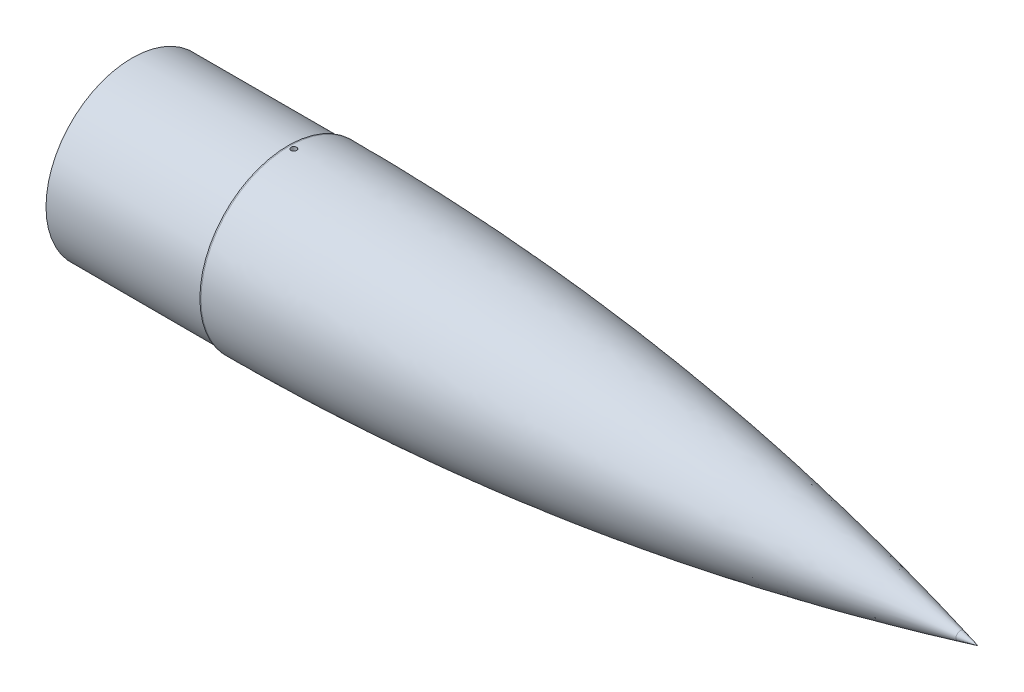
from build123d import *
from build123d.topology import SkipClean

# Parameters (mm, degrees)
ESQUISSE2_R                  = 76
ESQUISSE2_R_2                = 74
BOSS_EXTRU_1_DEPTH           = 138
ENL_V_MAT_EXTRU_1_DEPTH      = 649.747842898
ENL_V_MAT_EXTRU_1_DEPTH_BACK = 649.747842898
ESQUISSE3_R                  = 2.5


with BuildPart() as part:
    # Esquisse1 → Révolution3 (revolve)
    with BuildSketch(Plane.XY):
        with BuildLine():
            Line((-501.300996115, 74), (-500.300996115, 74))
            add(Edge.make_bspline(
                [(-500.300996115, 74), (-205.033047174, 74), (91.764741907, 0)],
                knots=[0, 0, 0, 1, 1, 1], degree=2))
            Line((91.764741907, 0), (108.299003885, 0))
            Line((108.299003885, 0), (92.73242949, 3.881182905))
            add(Edge.make_bspline(
                [(-500.300996115, 78), (-475.642620813, 78), (-426.347775001, 77.227857011), (-327.655384553, 72.595044211), (-228.880403388, 63.329565703), (-130.008955254, 49.431853826), (-68.17659714, 38.81586159), (-18.687478169, 29.165105527), (18.439887897, 21.348330719), (49.391507437, 14.351271458), (74.152443409, 8.465691784), (86.545764546, 5.42369172), (92.73242949, 3.881182905)],
                knots=[0, 0, 0, 0, 0.125, 0.25, 0.5, 0.625, 0.75, 0.8125, 0.875, 0.9375, 0.96875, 1, 1, 1, 1], degree=3))
            Line((-500.300996115, 78), (-501.300996115, 78))
            Line((-501.300996115, 78), (-501.300996115, 74))
        make_face()
    revolve(axis=Axis((-218.288054544, 0, 0), (1, 0, 0)))

    # Esquisse2 → Boss.-Extru.1 (add)
    with SkipClean():  # the faces are left unmerged after this step: merging them gives an invalid solid
        with BuildSketch(Plane.ZY.offset(501.300996115)):
            Circle(ESQUISSE2_R)
            Circle(ESQUISSE2_R_2, mode=Mode.SUBTRACT)
        extrude(amount=BOSS_EXTRU_1_DEPTH)

    # Esquisse3 → Enlèv. mat.-Extru.1 (cut, two sides: drawn at the far end of the back side and taken through both)
    with SkipClean():  # the faces are left unmerged after this step: merging them gives an invalid solid
        with BuildSketch(Plane(origin=(0, 0, 0), x_dir=(1, 0, 0), z_dir=(0, 1, 0)).offset(-ENL_V_MAT_EXTRU_1_DEPTH_BACK)):
            with Locations((-496.300996115, 0)):
                Circle(ESQUISSE3_R)
        extrude(amount=ENL_V_MAT_EXTRU_1_DEPTH + ENL_V_MAT_EXTRU_1_DEPTH_BACK, mode=Mode.SUBTRACT)


solid = part.part
